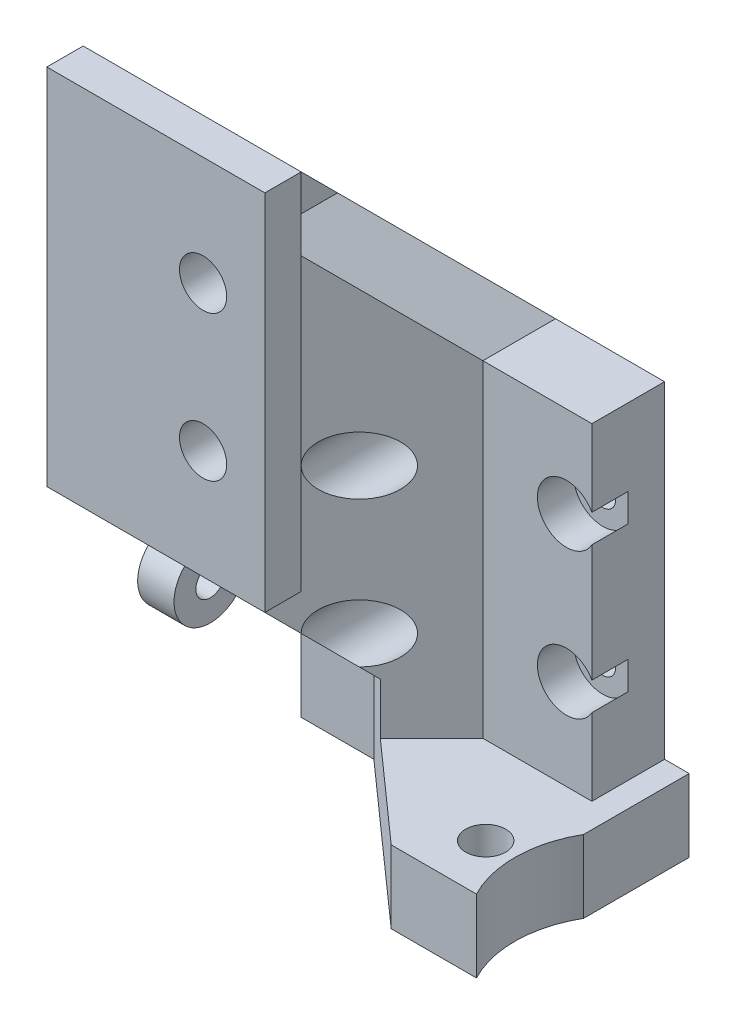
from build123d import *

# Parameters (mm, degrees)
ESQUISSE1_W             = 40
ESQUISSE1_H             = 45
ESQUISSE1_R             = 1.75
BOSS_EXTRU_1_DEPTH      = 10
ESQUISSE2_R             = 4
ENL_V_MAT_EXTRU_2_DEPTH = 5
BOSS_EXTRU_2_DEPTH      = 10
ESQUISSE4_W             = 5
ESQUISSE4_H             = 50
BOSS_EXTRU_3_DEPTH      = 20
ENL_V_MAT_EXTRU_3_REACH = 106.163
ESQUISSE5_R             = 3.25
ESQUISSE8_R             = 2.75
BOSS_EXTRU_8_DEPTH      = 10
ENL_V_MAT_EXTRU_5_REACH = 114.472
ESQUISSE9_R             = 15
CHANFREIN2_SIZE         = 15
ENL_V_MAT_EXTRU_4_REACH = 104.103
CHANFREIN3_SIZE         = 3.5
BOSS_EXTRU_4_DEPTH      = 5


# Some blends are built 0.0001 mm under size
with BuildPart() as part:
    # Esquisse1 → Boss.-Extru.1 (new body)
    with BuildSketch(Plane.XY):
        with Locations((-20, 22.5)):
            Rectangle(ESQUISSE1_W, ESQUISSE1_H)
        with Locations((-3.5, 32.5)):
            Circle(ESQUISSE1_R, mode=Mode.SUBTRACT)
        with Locations((-23.5, 32.5)):
            Circle(ESQUISSE1_R, mode=Mode.SUBTRACT)
        with Locations((-23.5, 12.5)):
            Circle(ESQUISSE1_R, mode=Mode.SUBTRACT)
        with Locations((-3.5, 12.5)):
            Circle(ESQUISSE1_R, mode=Mode.SUBTRACT)
    extrude(amount=BOSS_EXTRU_1_DEPTH)

    # Esquisse2 → Enlèv. mat.-Extru.2 (cut)
    with BuildSketch(Plane.XY.offset(10)):
        with Locations((-23.5, 32.5)):
            Circle(ESQUISSE2_R)
        with Locations((-3.5, 32.5)):
            Circle(ESQUISSE2_R)
        with Locations((-23.5, 12.5)):
            Circle(ESQUISSE2_R)
        with Locations((-3.5, 12.5)):
            Circle(ESQUISSE2_R)
    extrude(amount=-ENL_V_MAT_EXTRU_2_DEPTH, mode=Mode.SUBTRACT)

    # Esquisse3 → Boss.-Extru.2 (add)
    with BuildSketch(Plane.ZY.offset(40)):
        Polygon((10, 0), (45, 35), (45, 85), (40, 85), (0, 45), (10, 45), align=None)
    extrude(amount=-BOSS_EXTRU_2_DEPTH)

    # Esquisse4 → Boss.-Extru.3 (add)
    with BuildSketch(Plane(origin=(-30, 0, 0), x_dir=(0, 0, -1), z_dir=(1, 0, 0))):
        with Locations((-42.5, 60)):
            Rectangle(ESQUISSE4_W, ESQUISSE4_H)
    extrude(amount=BOSS_EXTRU_3_DEPTH)

    # Esquisse5 → Enlèv. mat.-Extru.3 (cut, up to next)
    with BuildSketch(Plane.XY.offset(45), mode=Mode.PRIVATE) as enl_v_mat_extru_3_sk1:
        with Locations((-18.5, 70)):
            Circle(ESQUISSE5_R)
    enl_v_mat_extru_3_tool1 = extrude(enl_v_mat_extru_3_sk1.sketch, amount=-ENL_V_MAT_EXTRU_3_REACH, mode=Mode.PRIVATE) & part.part
    # Esquisse5 → Enlèv. mat.-Extru.3 (cut, up to next)
    with BuildSketch(Plane.XY.offset(45), mode=Mode.PRIVATE) as enl_v_mat_extru_3_sk2:
        with Locations((-18.5, 50)):
            Circle(ESQUISSE5_R)
    enl_v_mat_extru_3_tool2 = extrude(enl_v_mat_extru_3_sk2.sketch, amount=-ENL_V_MAT_EXTRU_3_REACH, mode=Mode.PRIVATE) & part.part
    add(enl_v_mat_extru_3_tool1.solids().sort_by_distance((-18.5, 70, 45))[0], mode=Mode.SUBTRACT)
    add(enl_v_mat_extru_3_tool2.solids().sort_by_distance((-18.5, 50, 45))[0], mode=Mode.SUBTRACT)

    # Esquisse8 → Boss.-Extru.8 (add)
    with BuildSketch(Plane.XZ):
        Polygon((3.3834406, 0), (-40, 0), (-40, 10), (-30, 10), (-8.6165594, 29), (3.3834406, 29), align=None)
        with Locations(Location((-2.6165594, 22, 0), (0, 0, 270))):
            Circle(ESQUISSE8_R, mode=Mode.SUBTRACT)
    extrude(amount=BOSS_EXTRU_8_DEPTH)

    # Esquisse9 → Enlèv. mat.-Extru.5 (cut, up to next)
    with BuildSketch(Plane.XZ.offset(10), mode=Mode.PRIVATE) as enl_v_mat_extru_5_sk1:
        with Locations((16.3834406, 22)):
            Circle(ESQUISSE9_R)
    enl_v_mat_extru_5_tool1 = extrude(enl_v_mat_extru_5_sk1.sketch, amount=-ENL_V_MAT_EXTRU_5_REACH, mode=Mode.PRIVATE) & part.part
    add(enl_v_mat_extru_5_tool1.solids().sort_by_distance((16.383441, -10, 22))[0], mode=Mode.SUBTRACT)

    # Chanfrein2
    # the kernel refuses this chamfer: 15 mm, written as the material it adds along each edge
    with BuildSketch(Plane(origin=(-30, 83.575244819, 10), x_dir=(1, 0, 0), z_dir=(0, -1, 0))) as chanfrein2_piece_1_section:
        Polygon((CHANFREIN2_SIZE, 0), (0, CHANFREIN2_SIZE), (0, 0), align=None)
    chanfrein2_piece_1 = extrude(amount=122.150489639, mode=Mode.PRIVATE)
    chanfrein2_piece_1 = split(chanfrein2_piece_1, bisect_by=Plane(origin=(-30, 69.28762241, 24.28762241), z_dir=(0, -0.707106781186543, 0.7071067811865521)), keep=Keep.TOP, mode=Mode.PRIVATE)
    chanfrein2_piece_1 = chanfrein2_piece_1 - Plane(origin=(-23.5, 12.5, 10), x_dir=(1, 0, 0), z_dir=(0, 0, 1)) * Cylinder(4, 305, mode=Mode.PRIVATE)
    chanfrein2_piece_1 = chanfrein2_piece_1 - Plane(origin=(-23.5, 32.5, 10), x_dir=(1, 0, 0), z_dir=(0, 0, 1)) * Cylinder(4, 305, mode=Mode.PRIVATE)
    chanfrein2_piece_1 = split(chanfrein2_piece_1, bisect_by=Plane(origin=(-30, 41.78762241, 51.78762241), z_dir=(0, 0.7071067811865328, -0.7071067811865622)), keep=Keep.TOP, mode=Mode.PRIVATE)
    chanfrein2_piece_1 = split(chanfrein2_piece_1, bisect_by=Plane(origin=(-41.78762241, 71.78762241, 10), z_dir=(-0.7071067811865475, -0.7071067811865477, 0)), keep=Keep.TOP, mode=Mode.PRIVATE)
    add(chanfrein2_piece_1)
    with BuildSketch(Plane(origin=(-30, 83.575244819, 10), x_dir=(1, 0, 0), z_dir=(0, -1, 0))) as chanfrein2_piece_2_section:
        Polygon((CHANFREIN2_SIZE, 0), (0, CHANFREIN2_SIZE), (0, 0), align=None)
    chanfrein2_piece_2 = extrude(amount=122.150489639, mode=Mode.PRIVATE)
    chanfrein2_piece_2 = split(chanfrein2_piece_2, bisect_by=Plane(origin=(-30, -10, 10), z_dir=(0, 1, 0)), keep=Keep.TOP, mode=Mode.PRIVATE)
    chanfrein2_piece_2 = split(chanfrein2_piece_2, bisect_by=Plane(origin=(-30, 41.78762241, 51.78762241), z_dir=(0, -0.7071067811865328, 0.7071067811865622)), keep=Keep.TOP, mode=Mode.PRIVATE)
    chanfrein2_piece_2 = split(chanfrein2_piece_2, bisect_by=Plane(origin=(-30, 83.575244819, 10), z_dir=(0.66421730691086, 0, -0.7475395435694919)), keep=Keep.TOP, mode=Mode.PRIVATE)
    add(chanfrein2_piece_2)
    with BuildSketch(Plane(origin=(-30, 45, -38.575244819), x_dir=(1, 0, 0), z_dir=(0, 0, 1))) as chanfrein2_piece_3_section:
        Polygon((CHANFREIN2_SIZE, 0), (0, CHANFREIN2_SIZE), (0, 0), align=None)
    chanfrein2_piece_3 = extrude(amount=87.150489639, mode=Mode.PRIVATE)
    chanfrein2_piece_3 = split(chanfrein2_piece_3, bisect_by=Plane(origin=(-30, 25.71237759, -19.28762241), z_dir=(0, -0.707106781186543, 0.7071067811865521)), keep=Keep.TOP, mode=Mode.PRIVATE)
    chanfrein2_piece_3 = split(chanfrein2_piece_3, bisect_by=Plane(origin=(1.78762241, 45, -6.78762241), z_dir=(-0.7071067811865476, 0, -0.7071067811865476)), keep=Keep.TOP, mode=Mode.PRIVATE)
    add(chanfrein2_piece_3)
    with BuildSketch(Plane(origin=(-30, 35, 40), x_dir=(0, 0, -1), z_dir=(0, 1, 0))) as chanfrein2_piece_4_section:
        Polygon((CHANFREIN2_SIZE, 0), (0, -CHANFREIN2_SIZE), (0, 0), align=None)
    chanfrein2_piece_4 = extrude(amount=88.575244819, mode=Mode.PRIVATE)
    chanfrein2_piece_4 = split(chanfrein2_piece_4, bisect_by=Plane(origin=(-30, 60, 15), z_dir=(0, -0.707106781186543, 0.7071067811865521)), keep=Keep.TOP, mode=Mode.PRIVATE)
    chanfrein2_piece_4 = chanfrein2_piece_4 - Plane(origin=(-18.5, 70, 40), x_dir=(1, 0, 0), z_dir=(0, 0, 1)) * Cylinder(3.25, 238, mode=Mode.PRIVATE)
    chanfrein2_piece_4 = chanfrein2_piece_4 - Plane(origin=(-18.5, 50, 40), x_dir=(1, 0, 0), z_dir=(0, 0, 1)) * Cylinder(3.25, 238, mode=Mode.PRIVATE)
    add(chanfrein2_piece_4)

    # Esquisse6 → Enlèv. mat.-Extru.4 (cut, up to next)
    with BuildSketch(Plane(origin=(0, 0, 40), x_dir=(-1, 0, 0), z_dir=(0, 0, -1)), mode=Mode.PRIVATE) as enl_v_mat_extru_4_sk1:
        with BuildLine():
            Line((10.5, 70), (10.5, 85))
            Line((10.5, 85), (26.5, 85))
            Line((26.5, 85), (26.5, 70))
            ThreePointArc((26.5, 70), (18.5, 62), (10.5, 70))
        make_face()
    enl_v_mat_extru_4_tool1 = extrude(enl_v_mat_extru_4_sk1.sketch, amount=ENL_V_MAT_EXTRU_4_REACH, mode=Mode.PRIVATE) & part.part
    # Esquisse6 → Enlèv. mat.-Extru.4 (cut, up to next)
    with BuildSketch(Plane(origin=(0, 0, 40), x_dir=(-1, 0, 0), z_dir=(0, 0, -1)), mode=Mode.PRIVATE) as enl_v_mat_extru_4_sk2:
        with BuildLine():
            Line((10.5, 50), (10.5, 35))
            Line((10.5, 35), (26.5, 35))
            Line((26.5, 35), (26.5, 50))
            ThreePointArc((26.5, 50), (18.5, 58), (10.5, 50))
        make_face()
    enl_v_mat_extru_4_tool2 = extrude(enl_v_mat_extru_4_sk2.sketch, amount=ENL_V_MAT_EXTRU_4_REACH, mode=Mode.PRIVATE) & part.part
    add(enl_v_mat_extru_4_tool1.solids().sort_by_distance((-18.5, 74.283507, 40))[0], mode=Mode.SUBTRACT)
    add(enl_v_mat_extru_4_tool2.solids().sort_by_distance((-18.5, 45.716493, 40))[0], mode=Mode.SUBTRACT)

    # Chanfrein3
    chanfrein3_edges = [part.edges().sort_by_distance(p)[0] for p in [
        (-30, 35, 35),
    ]]
    chamfer(chanfrein3_edges, length=CHANFREIN3_SIZE - 0.0001)  # a hair under: the kernel refuses the full size

    # Esquisse7 → Boss.-Extru.4 (add)
    with BuildSketch(Plane.ZY.offset(40)):
        with BuildLine():
            Line((28.914213562, 18.914213562), (31.035533906, 21.035533906))
            ThreePointArc((31.035533906, 21.035533906), (31.035533906, 13.964466094), (23.964466094, 13.964466094))
            Line((23.964466094, 13.964466094), (26.085786438, 16.085786438))
            ThreePointArc((26.085786438, 16.085786438), (28.914213562, 16.085786438), (28.914213562, 18.914213562))
        make_face()
    extrude(amount=-BOSS_EXTRU_4_DEPTH)


solid = part.part
